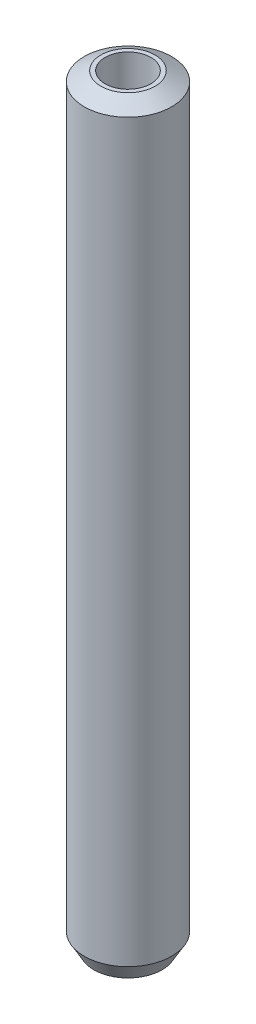
from build123d import *
from OCP.BRepFilletAPI import BRepFilletAPI_MakeChamfer

# Parameters (mm, degrees)
SKETCH1_R           = 10
BOSS_EXTRUDE1_DEPTH = 174.524713985
SKETCH2_R           = 5.245855193
CUT_EXTRUDE1_DEPTH  = 176.096761226
CHAMFER1_SIZE       = 2.189613982
CHAMFER1_SIZE2      = 3.792522666


with BuildPart() as part:
    # Sketch1 → Boss-Extrude1 (new body)
    with BuildSketch(Plane(origin=(0, 0, 0), x_dir=(1, 0, 0), z_dir=(0, 1, 0))):
        Circle(SKETCH1_R)
    extrude(amount=BOSS_EXTRUDE1_DEPTH)

    # Sketch2 → Cut-Extrude1 (cut, through all)
    with BuildSketch(Plane(origin=(0, 0, 0), x_dir=(1, 0, 0), z_dir=(0, 1, 0))):
        Circle(SKETCH2_R)
    extrude(amount=CUT_EXTRUDE1_DEPTH, mode=Mode.SUBTRACT)

    # Chamfer1: one chamfer whose edges measure the first distance from different faces: ONE call of the kernel's chamfer builder (chamfer() names one face for all edges)
    chamfer1_edges_1 = [part.edges().sort_by_distance(p)[0] for p in [
        (-10, 174.524713985, 0),
    ]]
    chamfer1_side_1 = [part.faces().sort_by_distance(p)[0] for p in [
        (-10, 87.262356993, 0),
    ]]
    chamfer1_edges_2 = [part.edges().sort_by_distance(p)[0] for p in [
        (-10, 0, 0),
    ]]
    chamfer1_side_2 = [part.faces().sort_by_distance(p)[0] for p in [
        (-9.717157288, 0, 0),
    ]]
    chamfer1 = BRepFilletAPI_MakeChamfer(part.part.solid().wrapped)
    for e in chamfer1_edges_1:
        chamfer1.Add(CHAMFER1_SIZE, CHAMFER1_SIZE2, e.wrapped, chamfer1_side_1[0].wrapped)  # the first distance lies on this face
    for e in chamfer1_edges_2:
        chamfer1.Add(CHAMFER1_SIZE, CHAMFER1_SIZE2, e.wrapped, chamfer1_side_2[0].wrapped)  # the first distance lies on this face
    add(Compound.cast(chamfer1.Shape()), mode=Mode.REPLACE)


solid = part.part
